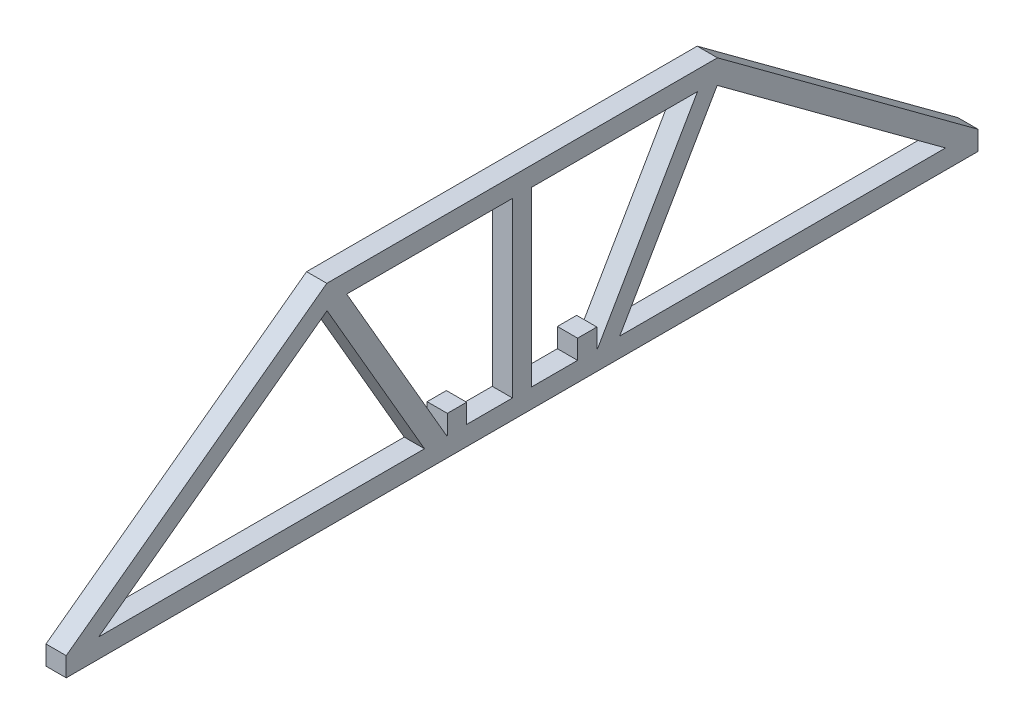
from build123d import *

# Parameters (mm, degrees)
EXTRUDE_THIN1_DEPTH = 10
SKETCH3_W           = 9.525
SKETCH3_H           = 9.525
BOSS_EXTRUDE1_DEPTH = 10
SKETCH4_W           = 25.457542158
SKETCH4_H           = 16.944951572
CUT_EXTRUDE1_DEPTH  = 12.917655
SKETCH5_W           = 71.291664715
SKETCH5_H           = 18.17592298
CUT_EXTRUDE2_DEPTH  = 12.917655


# Read off the part's stored shape, not the designer's step: Extrude-Thin1
with BuildPart() as part:
    # Extrude-Thin1 outline → Extrude-Thin1 (new body)
    with BuildSketch(Plane(origin=(9.525, 0, 0), x_dir=(0, 0, -1), z_dir=(1, 0, 0))):
        Polygon((-323.6, 99.7625), (-323.6, 95), (-326.426404213, 98.833124766), (-466.921154801, -4.7625), (9.721154801, -4.7625), (-130.773595787, 98.833124766), (-133.6, 95), (-133.6, 99.7625), align=None)
        Polygon((-276.860305191, 4.7625), (-437.953845199, 4.7625), (-325.055829502, 88.009314718), align=None, mode=Mode.SUBTRACT)
        Polygon((-180.339694809, 4.7625), (-132.144170498, 88.009314718), (-19.246154801, 4.7625), align=None, mode=Mode.SUBTRACT)
        Polygon((-315.339694809, 90.2375), (-233.3625, 90.2375), (-233.3625, 4.7625), (-265.854168493, 4.7625), align=None, mode=Mode.SUBTRACT)
        Polygon((-223.8375, 90.2375), (-141.860305191, 90.2375), (-191.345831507, 4.7625), (-223.8375, 4.7625), align=None, mode=Mode.SUBTRACT)
    extrude(amount=EXTRUDE_THIN1_DEPTH)

    # Sketch3 → Boss-Extrude1 (add)
    with BuildSketch(Plane(origin=(19.525, 0, 0), x_dir=(0, 0, -1), z_dir=(1, 0, 0))):
        Polygon((-133.6, 99.7625), (-133.6, 95), (-130.773595787, 98.833124766), (-132.033999804, 99.7625), align=None)
        Polygon((-326.426404213, 98.833124766), (-323.6, 95), (-323.6, 99.7625), (-325.166000196, 99.7625), align=None)
        Polygon((9.721154801, 4.7625), (-3.196499804, 4.7625), (9.721154801, -4.7625), align=None)
        Polygon((-466.921154801, -4.7625), (-454.003500196, 4.7625), (-466.921154801, 4.7625), align=None)
        with Locations((-260.802793514, 9.525)):
            Rectangle(SKETCH3_W, SKETCH3_H)
        with Locations((-196.397206486, 9.525)):
            Rectangle(SKETCH3_W, SKETCH3_H)
    extrude(amount=-BOSS_EXTRUDE1_DEPTH)

    # Sketch4 → Cut-Extrude1 (cut)
    with BuildSketch(Plane(origin=(0, 0, -9.721154801), x_dir=(-1, 0, 0), z_dir=(0, 0, -1))):
        with Locations((-19.165581616, -1.578540654)):
            Rectangle(SKETCH4_W, SKETCH4_H)
    extrude(amount=-CUT_EXTRUDE1_DEPTH, mode=Mode.SUBTRACT)

    # Sketch5 → Cut-Extrude2 (cut)
    with BuildSketch(Plane.XY.offset(466.921154801)):
        with Locations((18.052286902, -0.452774422)):
            Rectangle(SKETCH5_W, SKETCH5_H)
    extrude(amount=-CUT_EXTRUDE2_DEPTH, mode=Mode.SUBTRACT)


solid = part.part
